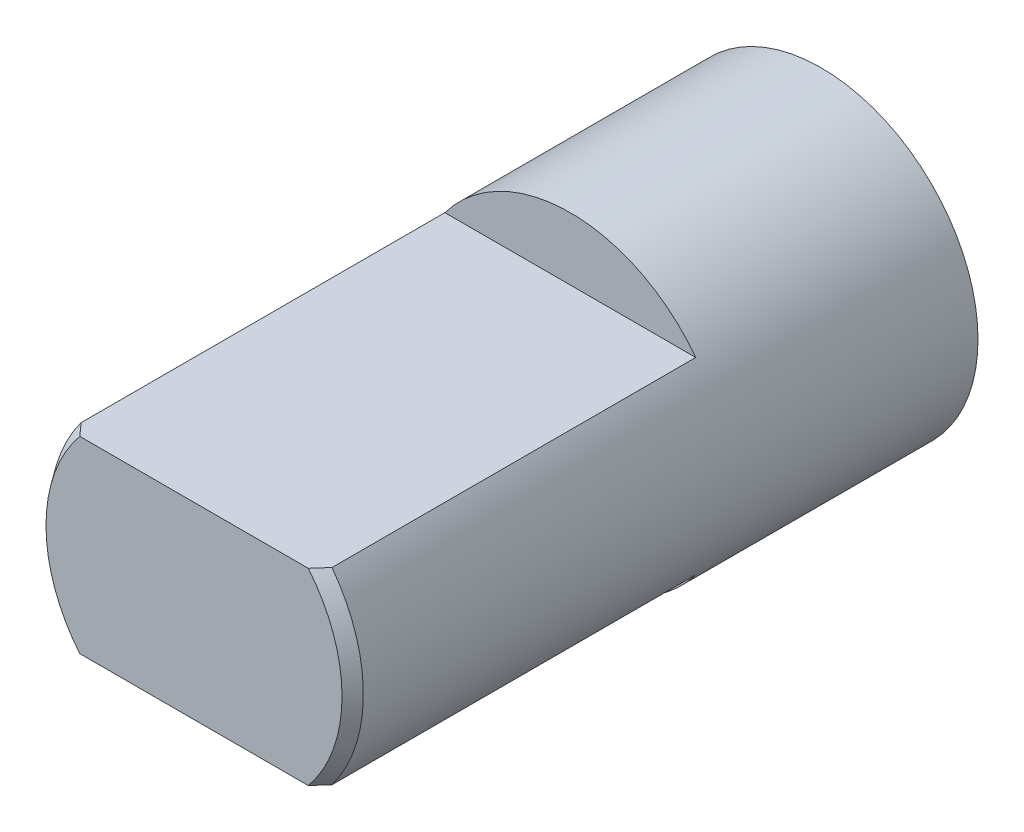
from build123d import *

# Parameters (mm, degrees)
SKETCH2_R           = 2.5
BOSS_EXTRUDE1_DEPTH = 10
CUT_EXTRUDE1_START  = -6
CUT_EXTRUDE1_DEPTH  = 6
CHAMFER1_SIZE       = 0.2
CHAMFER1_SIZE2      = 0.140041508


with BuildPart() as part:
    # Sketch2 → Boss-Extrude1 (new body)
    with BuildSketch(Plane.XY):
        Circle(SKETCH2_R)
    extrude(amount=BOSS_EXTRUDE1_DEPTH)

    # Sketch3 → Cut-Extrude1 (cut)
    with BuildSketch(Plane.XY.offset(10).offset(CUT_EXTRUDE1_START)):
        with BuildLine():
            Line((-2, 1.5), (2, 1.5))
            ThreePointArc((2, 1.5), (0, 2.5), (-2, 1.5))
        make_face()
        with BuildLine():
            Line((-2, -1.5), (2, -1.5))
            ThreePointArc((2, -1.5), (0, -2.5), (-2, -1.5))
        make_face()
    extrude(amount=CUT_EXTRUDE1_DEPTH, mode=Mode.SUBTRACT)

    # Chamfer1
    chamfer1_edges = [part.edges().sort_by_distance(p)[0] for p in [
        (-2.5, 0, 10),
        (2.371708245, -0.790569415, 10),
    ]]
    chamfer1_side = [part.faces().sort_by_distance(p)[0] for p in [
        (-2.5, 0, 5),
    ]]
    chamfer(chamfer1_edges, length=CHAMFER1_SIZE, length2=CHAMFER1_SIZE2, reference=chamfer1_side[0])


solid = part.part
